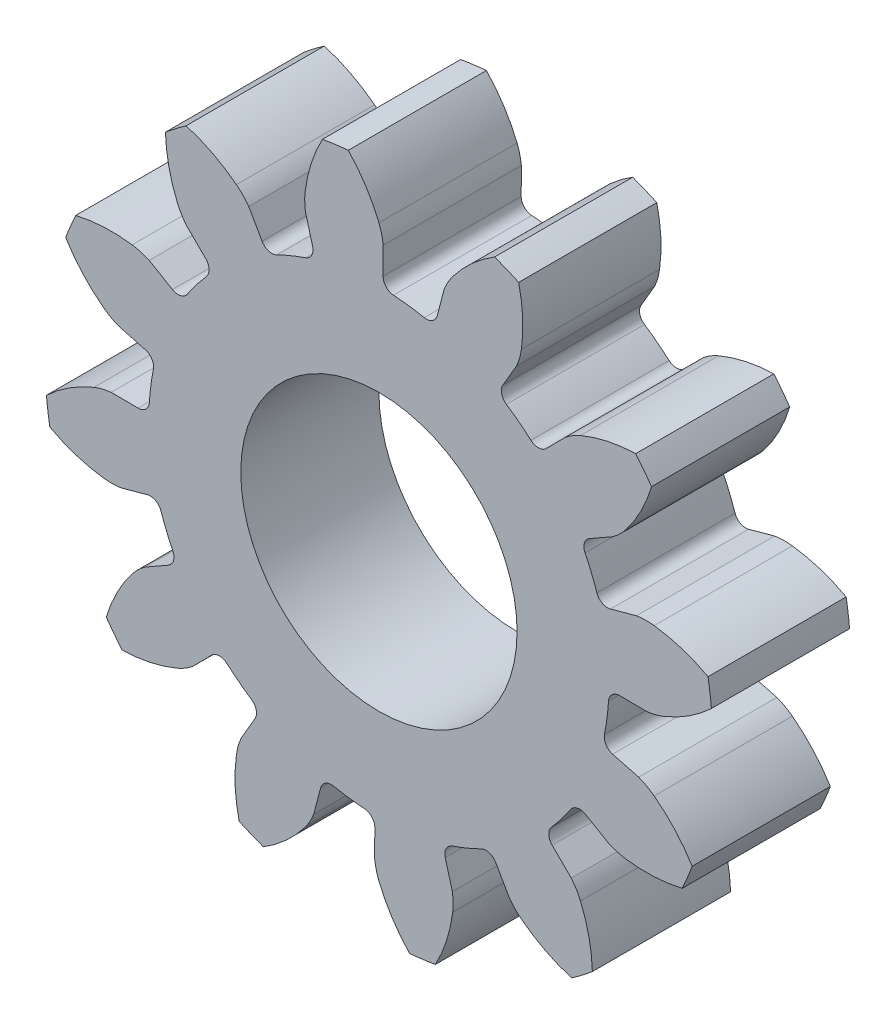
from build123d import *

# Parameters (mm, degrees)
SKETCH1_R           = 2
BOSS_EXTRUDE1_DEPTH = 2


with BuildPart() as part:
    # Sketch1 → Boss-Extrude1 (new body)
    with BuildSketch(Plane.XY):
        with BuildLine():
            Line((-1.063154236, 3.728403585), (-0.959903592, 3.351855041))
            ThreePointArc((-0.959903592, 3.351855041), (-0.973112709, 3.232970926), (-1.06432333, 3.155585293))
            ThreePointArc((-1.06432333, 3.155585293), (-1.274427917, 3.076741162), (-1.478745516, 2.983926003))
            ThreePointArc((-1.478745516, 2.983926003), (-1.59796107, 2.974150261), (-1.69136509, 3.048873768))
            Line((-1.69136509, 3.048873768), (-1.884615888, 3.388143028))
            ThreePointArc((-1.884615888, 3.388143028), (-1.967010513, 3.486865614), (-2.06262217, 3.572850694))
            ThreePointArc((-2.06262217, 3.572850694), (-2.409218227, 3.793908043), (-2.790794088, 3.946862419))
            ThreePointArc((-2.790794088, 3.946862419), (-2.942670802, 3.834963253), (-3.090065683, 3.717223247))
            ThreePointArc((-3.090065683, 3.717223247), (-3.0410822, 3.309061764), (-2.917262859, 2.917061829))
            ThreePointArc((-2.917262859, 2.917061829), (-2.858953766, 2.802453484), (-2.784920369, 2.697315102))
            Line((-2.784920369, 2.697315102), (-2.507228416, 2.422839819))
            ThreePointArc((-2.507228416, 2.422839819), (-2.45922579, 2.313278597), (-2.499523688, 2.200655363))
            ThreePointArc((-2.499523688, 2.200655363), (-2.642057533, 2.027322049), (-2.772594184, 1.844782964))
            ThreePointArc((-2.772594184, 1.844782964), (-2.870950011, 1.776709146), (-2.989202019, 1.794719591))
            Line((-2.989202019, 1.794719591), (-3.32619675, 1.99190999))
            ThreePointArc((-3.32619675, 1.99190999), (-3.446913881, 2.036208945), (-3.572708545, 2.06286838))
            ThreePointArc((-3.572708545, 2.06286838), (-3.98339821, 2.081011631), (-4.390329786, 2.022686077))
            ThreePointArc((-4.390329786, 2.022686077), (-4.465909295, 1.849840199), (-4.534687004, 1.674176923))
            ThreePointArc((-4.534687004, 1.674176923), (-4.288185322, 1.34519045), (-3.98495466, 1.067618219))
            ThreePointArc((-3.98495466, 1.067618219), (-3.877153332, 0.997519026), (-3.760469339, 0.943483216))
            Line((-3.760469339, 0.943483216), (-3.382743411, 0.844626624))
            ThreePointArc((-3.382743411, 0.844626624), (-3.286391306, 0.773745136), (-3.264978693, 0.656061605))
            ThreePointArc((-3.264978693, 0.656061605), (-3.301749966, 0.434683629), (-3.32352848, 0.211331819))
            ThreePointArc((-3.32352848, 0.211331819), (-3.374670215, 0.10320025), (-3.486084681, 0.059671749))
            Line((-3.486084681, 0.059671749), (-3.876525878, 0.061946278))
            ThreePointArc((-3.876525878, 0.061946278), (-4.003219457, 0.039951733), (-4.12549055, 0.00014215))
            ThreePointArc((-4.12549055, 0.00014215), (-4.490229858, -0.189490167), (-4.813480164, -0.443467367))
            ThreePointArc((-4.813480164, -0.443467367), (-4.792511, -0.630946043), (-4.764242605, -0.817463757))
            ThreePointArc((-4.764242605, -0.817463757), (-4.38627265, -0.979123558), (-3.984881077, -1.067892831))
            ThreePointArc((-3.984881077, -1.067892831), (-3.856472793, -1.074699848), (-3.728403585, -1.063154236))
            Line((-3.728403585, -1.063154236), (-3.351855041, -0.959903592))
            ThreePointArc((-3.351855041, -0.959903592), (-3.232970926, -0.973112709), (-3.155585293, -1.06432333))
            ThreePointArc((-3.155585293, -1.06432333), (-3.076741162, -1.274427917), (-2.983926003, -1.478745516))
            ThreePointArc((-2.983926003, -1.478745516), (-2.974150261, -1.59796107), (-3.048873768, -1.69136509))
            Line((-3.048873768, -1.69136509), (-3.388143028, -1.884615888))
            ThreePointArc((-3.388143028, -1.884615888), (-3.486865614, -1.967010513), (-3.572850694, -2.06262217))
            ThreePointArc((-3.572850694, -2.06262217), (-3.793908043, -2.409218227), (-3.946862419, -2.790794088))
            ThreePointArc((-3.946862419, -2.790794088), (-3.834963253, -2.942670802), (-3.717223247, -3.090065683))
            ThreePointArc((-3.717223247, -3.090065683), (-3.309061764, -3.0410822), (-2.917061829, -2.917262859))
            ThreePointArc((-2.917061829, -2.917262859), (-2.802453484, -2.858953766), (-2.697315102, -2.784920369))
            Line((-2.697315102, -2.784920369), (-2.422839819, -2.507228416))
            ThreePointArc((-2.422839819, -2.507228416), (-2.313278597, -2.45922579), (-2.200655363, -2.499523688))
            ThreePointArc((-2.200655363, -2.499523688), (-2.027322049, -2.642057533), (-1.844782964, -2.772594184))
            ThreePointArc((-1.844782964, -2.772594184), (-1.776709146, -2.870950011), (-1.794719591, -2.989202019))
            Line((-1.794719591, -2.989202019), (-1.99190999, -3.32619675))
            ThreePointArc((-1.99190999, -3.32619675), (-2.036208945, -3.446913881), (-2.06286838, -3.572708545))
            ThreePointArc((-2.06286838, -3.572708545), (-2.081011631, -3.98339821), (-2.022686077, -4.390329786))
            ThreePointArc((-2.022686077, -4.390329786), (-1.849840199, -4.465909295), (-1.674176923, -4.534687004))
            ThreePointArc((-1.674176923, -4.534687004), (-1.34519045, -4.288185322), (-1.067618219, -3.98495466))
            ThreePointArc((-1.067618219, -3.98495466), (-0.997519026, -3.877153332), (-0.943483216, -3.760469339))
            Line((-0.943483216, -3.760469339), (-0.844626624, -3.382743411))
            ThreePointArc((-0.844626624, -3.382743411), (-0.773745136, -3.286391306), (-0.656061605, -3.264978693))
            ThreePointArc((-0.656061605, -3.264978693), (-0.434683629, -3.301749966), (-0.211331819, -3.32352848))
            ThreePointArc((-0.211331819, -3.32352848), (-0.10320025, -3.374670215), (-0.059671749, -3.486084681))
            Line((-0.059671749, -3.486084681), (-0.061946278, -3.876525878))
            ThreePointArc((-0.061946278, -3.876525878), (-0.039951733, -4.003219457), (-0.00014215, -4.12549055))
            ThreePointArc((-0.00014215, -4.12549055), (0.189490167, -4.490229858), (0.443467367, -4.813480164))
            ThreePointArc((0.443467367, -4.813480164), (0.630946043, -4.792511), (0.817463757, -4.764242605))
            ThreePointArc((0.817463757, -4.764242605), (0.979123558, -4.38627265), (1.067892831, -3.984881077))
            ThreePointArc((1.067892831, -3.984881077), (1.074699848, -3.856472793), (1.063154236, -3.728403585))
            Line((1.063154236, -3.728403585), (0.959903592, -3.351855041))
            ThreePointArc((0.959903592, -3.351855041), (0.973112709, -3.232970926), (1.06432333, -3.155585293))
            ThreePointArc((1.06432333, -3.155585293), (1.274427917, -3.076741162), (1.478745516, -2.983926003))
            ThreePointArc((1.478745516, -2.983926003), (1.59796107, -2.974150261), (1.69136509, -3.048873768))
            Line((1.69136509, -3.048873768), (1.884615888, -3.388143028))
            ThreePointArc((1.884615888, -3.388143028), (1.967010513, -3.486865614), (2.06262217, -3.572850694))
            ThreePointArc((2.06262217, -3.572850694), (2.409218227, -3.793908043), (2.790794088, -3.946862419))
            ThreePointArc((2.790794088, -3.946862419), (2.942670802, -3.834963253), (3.090065683, -3.717223247))
            ThreePointArc((3.090065683, -3.717223247), (3.0410822, -3.309061764), (2.917262859, -2.917061829))
            ThreePointArc((2.917262859, -2.917061829), (2.858953766, -2.802453484), (2.784920369, -2.697315102))
            Line((2.784920369, -2.697315102), (2.507228416, -2.422839819))
            ThreePointArc((2.507228416, -2.422839819), (2.45922579, -2.313278597), (2.499523688, -2.200655363))
            ThreePointArc((2.499523688, -2.200655363), (2.642057533, -2.027322049), (2.772594184, -1.844782964))
            ThreePointArc((2.772594184, -1.844782964), (2.870950011, -1.776709146), (2.989202019, -1.794719591))
            Line((2.989202019, -1.794719591), (3.32619675, -1.99190999))
            ThreePointArc((3.32619675, -1.99190999), (3.446913881, -2.036208945), (3.572708545, -2.06286838))
            ThreePointArc((3.572708545, -2.06286838), (3.98339821, -2.081011631), (4.390329786, -2.022686077))
            ThreePointArc((4.390329786, -2.022686077), (4.465909295, -1.849840199), (4.534687004, -1.674176923))
            ThreePointArc((4.534687004, -1.674176923), (4.288185322, -1.34519045), (3.98495466, -1.067618219))
            ThreePointArc((3.98495466, -1.067618219), (3.877153332, -0.997519026), (3.760469339, -0.943483216))
            Line((3.760469339, -0.943483216), (3.382743411, -0.844626624))
            ThreePointArc((3.382743411, -0.844626624), (3.286391306, -0.773745136), (3.264978693, -0.656061605))
            ThreePointArc((3.264978693, -0.656061605), (3.301749966, -0.434683629), (3.32352848, -0.211331819))
            ThreePointArc((3.32352848, -0.211331819), (3.374670215, -0.10320025), (3.486084681, -0.059671749))
            Line((3.486084681, -0.059671749), (3.876525878, -0.061946278))
            ThreePointArc((3.876525878, -0.061946278), (4.003219457, -0.039951733), (4.12549055, -0.00014215))
            ThreePointArc((4.12549055, -0.00014215), (4.490229858, 0.189490167), (4.813480164, 0.443467367))
            ThreePointArc((4.813480164, 0.443467367), (4.792511, 0.630946043), (4.764242605, 0.817463757))
            ThreePointArc((4.764242605, 0.817463757), (4.38627265, 0.979123558), (3.984881077, 1.067892831))
            ThreePointArc((3.984881077, 1.067892831), (3.856472793, 1.074699848), (3.728403585, 1.063154236))
            Line((3.728403585, 1.063154236), (3.351855041, 0.959903592))
            ThreePointArc((3.351855041, 0.959903592), (3.232970926, 0.973112709), (3.155585293, 1.06432333))
            ThreePointArc((3.155585293, 1.06432333), (3.076741162, 1.274427917), (2.983926003, 1.478745516))
            ThreePointArc((2.983926003, 1.478745516), (2.974150261, 1.59796107), (3.048873768, 1.69136509))
            Line((3.048873768, 1.69136509), (3.388143028, 1.884615888))
            ThreePointArc((3.388143028, 1.884615888), (3.486865614, 1.967010513), (3.572850694, 2.06262217))
            ThreePointArc((3.572850694, 2.06262217), (3.793908043, 2.409218227), (3.946862419, 2.790794088))
            ThreePointArc((3.946862419, 2.790794088), (3.834963253, 2.942670802), (3.717223247, 3.090065683))
            ThreePointArc((3.717223247, 3.090065683), (3.309061764, 3.0410822), (2.917061829, 2.917262859))
            ThreePointArc((2.917061829, 2.917262859), (2.802453484, 2.858953766), (2.697315102, 2.784920369))
            Line((2.697315102, 2.784920369), (2.422839819, 2.507228416))
            ThreePointArc((2.422839819, 2.507228416), (2.313278597, 2.45922579), (2.200655363, 2.499523688))
            ThreePointArc((2.200655363, 2.499523688), (2.027322049, 2.642057533), (1.844782964, 2.772594184))
            ThreePointArc((1.844782964, 2.772594184), (1.776709146, 2.870950011), (1.794719591, 2.989202019))
            Line((1.794719591, 2.989202019), (1.99190999, 3.32619675))
            ThreePointArc((1.99190999, 3.32619675), (2.036208945, 3.446913881), (2.06286838, 3.572708545))
            ThreePointArc((2.06286838, 3.572708545), (2.081011631, 3.98339821), (2.022686077, 4.390329786))
            ThreePointArc((2.022686077, 4.390329786), (1.849840199, 4.465909295), (1.674176923, 4.534687004))
            ThreePointArc((1.674176923, 4.534687004), (1.34519045, 4.288185322), (1.067618219, 3.98495466))
            ThreePointArc((1.067618219, 3.98495466), (0.997519026, 3.877153332), (0.943483216, 3.760469339))
            Line((0.943483216, 3.760469339), (0.844626624, 3.382743411))
            ThreePointArc((0.844626624, 3.382743411), (0.773745136, 3.286391306), (0.656061605, 3.264978693))
            ThreePointArc((0.656061605, 3.264978693), (0.434683629, 3.301749966), (0.211331819, 3.32352848))
            ThreePointArc((0.211331819, 3.32352848), (0.10320025, 3.374670215), (0.059671749, 3.486084681))
            Line((0.059671749, 3.486084681), (0.061946278, 3.876525878))
            ThreePointArc((0.061946278, 3.876525878), (0.039951733, 4.003219457), (0.00014215, 4.12549055))
            ThreePointArc((0.00014215, 4.12549055), (-0.189490167, 4.490229858), (-0.443467367, 4.813480164))
            ThreePointArc((-0.443467367, 4.813480164), (-0.630946043, 4.792511), (-0.817463757, 4.764242605))
            ThreePointArc((-0.817463757, 4.764242605), (-0.979123558, 4.38627265), (-1.067892831, 3.984881077))
            ThreePointArc((-1.067892831, 3.984881077), (-1.074699848, 3.856472793), (-1.063154236, 3.728403585))
        make_face()
        Circle(SKETCH1_R, mode=Mode.SUBTRACT)
    extrude(amount=BOSS_EXTRUDE1_DEPTH)


solid = part.part
